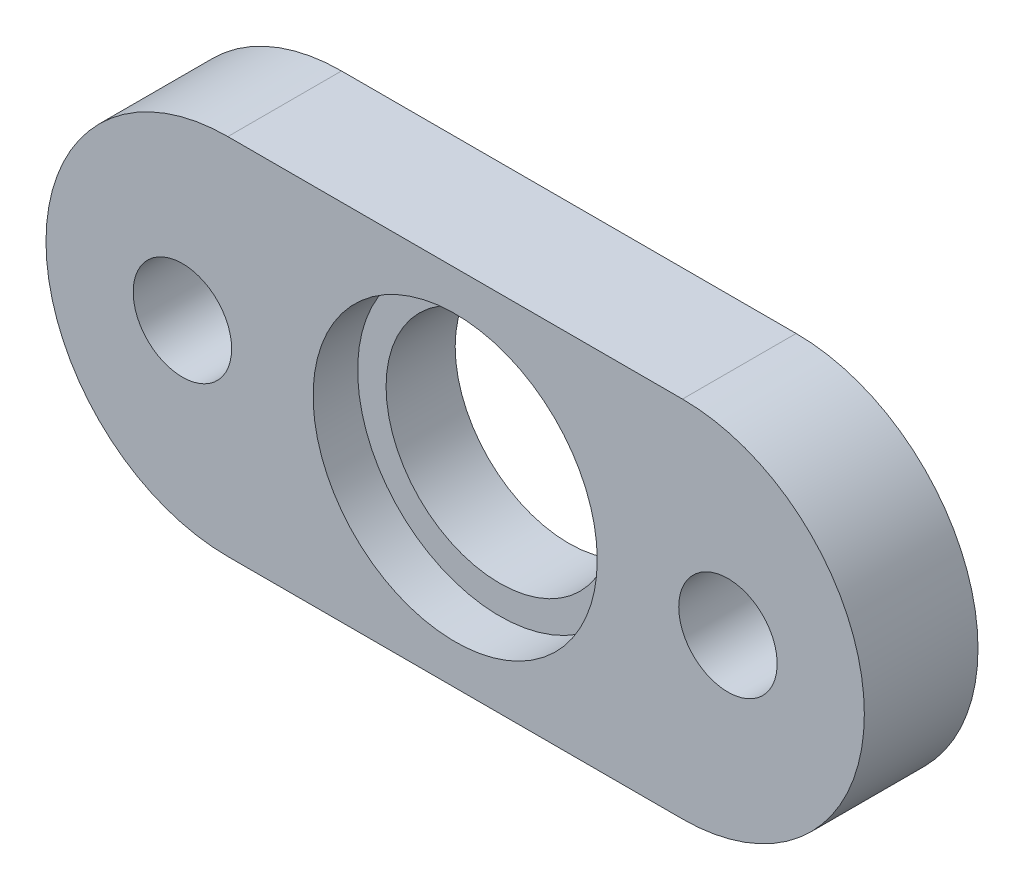
from build123d import *

# Parameters (mm, degrees)
BOSS_EXTRUDE5_DEPTH = 6.35
SKETCH5_R           = 7.9375
CUT_EXTRUDE3_DEPTH  = 2.4892
SKETCH6_R           = 6.35
SKETCH6_R_2         = 2.75
CUT_EXTRUDE4_DEPTH  = 26.80944982


with BuildPart() as part:
    # Sketch2 → Boss-Extrude5 (new body)
    with BuildSketch(Plane.XY):
        with BuildLine():
            Line((-12.7, 10.16), (12.7, 10.16))
            ThreePointArc((12.7, 10.16), (22.86, 0), (12.7, -10.16))
            Line((12.7, -10.16), (-12.7, -10.16))
            ThreePointArc((-12.7, -10.16), (-22.86, 0), (-12.7, 10.16))
        make_face()
    extrude(amount=BOSS_EXTRUDE5_DEPTH)

    # Sketch5 → Cut-Extrude3 (cut)
    with BuildSketch(Plane.XY.offset(6.35)):
        Circle(SKETCH5_R)
    extrude(amount=-CUT_EXTRUDE3_DEPTH, mode=Mode.SUBTRACT)

    # Sketch6 → Cut-Extrude4 (cut, through all)
    with BuildSketch(Plane.XY.offset(6.35)):
        Circle(SKETCH6_R)
        with Locations((-15.24, 0)):
            Circle(SKETCH6_R_2)
        with Locations((15.24, 0)):
            Circle(SKETCH6_R_2)
    extrude(amount=-CUT_EXTRUDE4_DEPTH, mode=Mode.SUBTRACT)


solid = part.part
